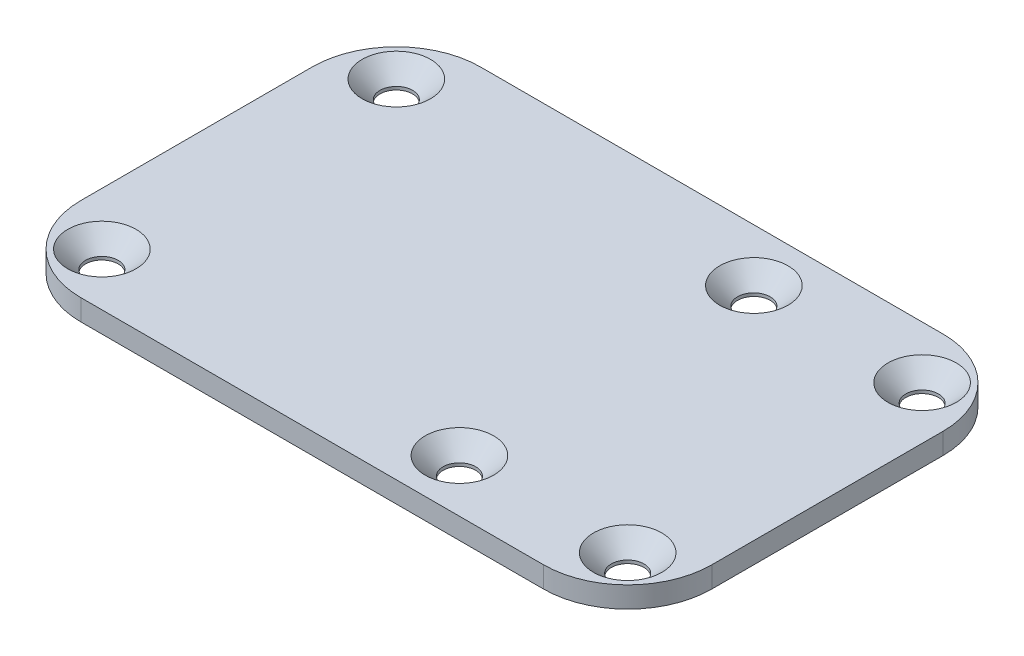
from build123d import *

# Parameters (mm, degrees)
BOSS_EXTRUDE1_DEPTH                 = 2
F_3_1_3_1_DIAMETER_HOLE1_AT_2_COUNT = 2
F_3_1_3_1_DIAMETER_HOLE1_AT_2_PITCH = 28
F_3_1_3_1_DIAMETER_HOLE1_AT_3_COUNT = 2
F_3_1_3_1_DIAMETER_HOLE1_AT_3_PITCH = 57.306195128
F_3_1_3_1_DIAMETER_HOLE1_AT_4_COUNT = 2
F_3_1_3_1_DIAMETER_HOLE1_AT_4_PITCH = 50
F_3_1_3_1_DIAMETER_HOLE1_AT_5_COUNT = 2
F_3_1_3_1_DIAMETER_HOLE1_AT_5_PITCH = 16
F_3_1_3_1_DIAMETER_HOLE1_AT_6_COUNT = 2
F_3_1_3_1_DIAMETER_HOLE1_AT_6_PITCH = 32.249030993


with BuildPart() as part:
    # Sketch1 → Boss-Extrude1 (new body)
    with BuildSketch(Plane(origin=(0, 0, 0), x_dir=(1, 0, 0), z_dir=(0, 1, 0))):
        with BuildLine():
            Line((22, -19), (-22, -19))
            ThreePointArc((-22, -19), (-27.656854249, -16.656854249), (-30, -11))
            Line((-30, -11), (-30, 11))
            ThreePointArc((-30, 11), (-27.656854249, 16.656854249), (-22, 19))
            Line((-22, 19), (22, 19))
            ThreePointArc((22, 19), (27.656854249, 16.656854249), (30, 11))
            Line((30, 11), (30, -11))
            ThreePointArc((30, -11), (27.656854249, -16.656854249), (22, -19))
        make_face()
    extrude(amount=BOSS_EXTRUDE1_DEPTH)

    # Hole → Ø3.1 (3.1) Diameter Hole1 (revolve, cut)
    with BuildSketch(Plane(origin=(25, 2, -14), x_dir=(0, 0, 1), z_dir=(1, 0, 0))):
        Polygon((0, 0), (0, 2), (1.55, 2), (1.55, 1.7), (3.25, 0), align=None)
    f_3_1_3_1_diameter_hole1 = revolve(axis=Axis((25, 8.35, -14), (0, -1, 0)), mode=Mode.SUBTRACT)

    # Ø3.1 (3.1) Diameter Hole1 at 2: Ø3.1 (3.1) Diameter Hole1 ×2
    with Locations(*[(0, 0, i * F_3_1_3_1_DIAMETER_HOLE1_AT_2_PITCH) for i in range(1, F_3_1_3_1_DIAMETER_HOLE1_AT_2_COUNT)]):
        add(f_3_1_3_1_diameter_hole1, mode=Mode.SUBTRACT)

    # Ø3.1 (3.1) Diameter Hole1 at 3: Ø3.1 (3.1) Diameter Hole1 ×2
    with Locations(*[Vector(-0.87250601594972, 0, 0.48860336893184336) * (i * F_3_1_3_1_DIAMETER_HOLE1_AT_3_PITCH) for i in range(1, F_3_1_3_1_DIAMETER_HOLE1_AT_3_COUNT)]):
        add(f_3_1_3_1_diameter_hole1, mode=Mode.SUBTRACT)

    # Ø3.1 (3.1) Diameter Hole1 at 4: Ø3.1 (3.1) Diameter Hole1 ×2
    with Locations(*[(-i * F_3_1_3_1_DIAMETER_HOLE1_AT_4_PITCH, 0, 0) for i in range(1, F_3_1_3_1_DIAMETER_HOLE1_AT_4_COUNT)]):
        add(f_3_1_3_1_diameter_hole1, mode=Mode.SUBTRACT)

    # Ø3.1 (3.1) Diameter Hole1 at 5: Ø3.1 (3.1) Diameter Hole1 ×2
    with Locations(*[(-i * F_3_1_3_1_DIAMETER_HOLE1_AT_5_PITCH, 0, 0) for i in range(1, F_3_1_3_1_DIAMETER_HOLE1_AT_5_COUNT)]):
        add(f_3_1_3_1_diameter_hole1, mode=Mode.SUBTRACT)

    # Ø3.1 (3.1) Diameter Hole1 at 6: Ø3.1 (3.1) Diameter Hole1 ×2
    with Locations(*[Vector(-0.4961389383568338, 0, 0.8682431421244593) * (i * F_3_1_3_1_DIAMETER_HOLE1_AT_6_PITCH) for i in range(1, F_3_1_3_1_DIAMETER_HOLE1_AT_6_COUNT)]):
        add(f_3_1_3_1_diameter_hole1, mode=Mode.SUBTRACT)


solid = part.part
